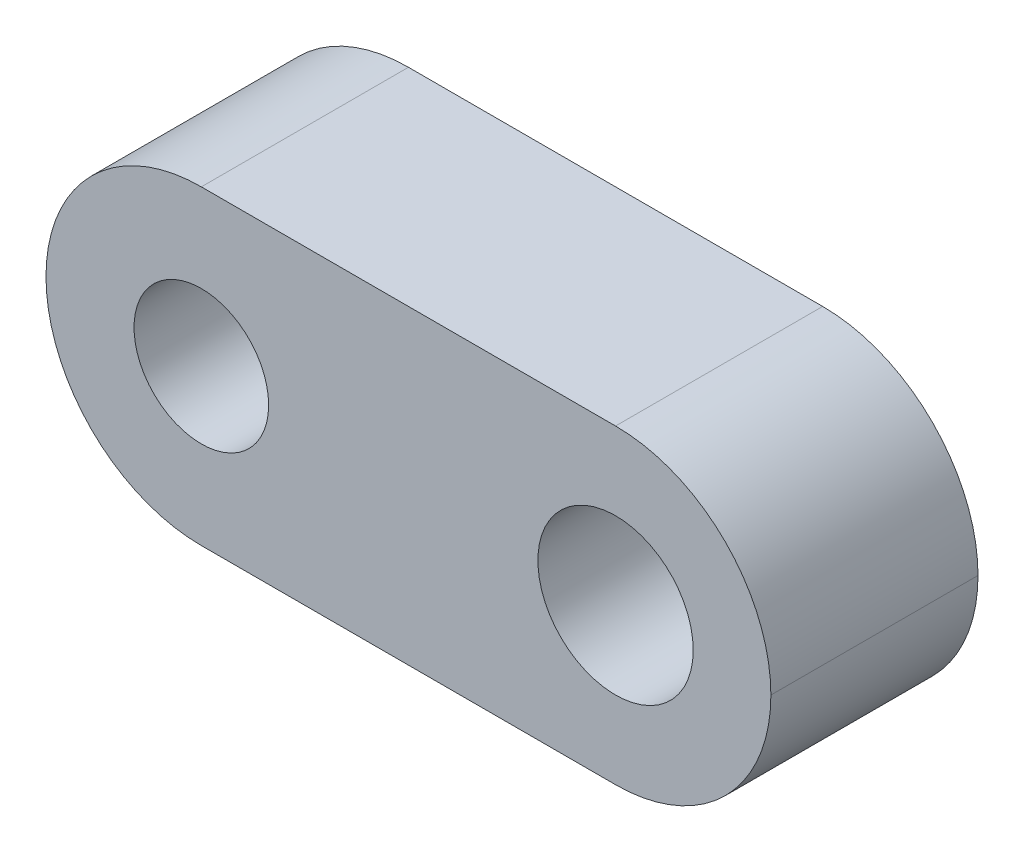
from build123d import *

# Parameters (mm, degrees)
SKETCH1_W               = 14
SKETCH1_H               = 6
BOSS_EXTRUDE1_DEPTH     = 4
CUT_EXTRUDE1_DEPTH      = 16.748015748
CUT_EXTRUDE1_DEPTH_BACK = 16.748015748
SKETCH2_R               = 1.3
SKETCH2_R_2             = 1.5
FILLET1_R               = 3


with BuildPart() as part:
    # Sketch1 → Boss-Extrude1 (new body)
    with BuildSketch(Plane.XY):
        with Locations((7, -3)):
            Rectangle(SKETCH1_W, SKETCH1_H)
    extrude(amount=BOSS_EXTRUDE1_DEPTH)

    # Sketch2 → Cut-Extrude1 (cut, two sides: drawn at the far end of the back side and taken through both)
    with BuildSketch(Plane.XY.offset(4).offset(-CUT_EXTRUDE1_DEPTH_BACK)):
        with Locations((3, -3)):
            Circle(SKETCH2_R)
        with Locations((11, -3)):
            Circle(SKETCH2_R_2)
    extrude(amount=CUT_EXTRUDE1_DEPTH + CUT_EXTRUDE1_DEPTH_BACK, mode=Mode.SUBTRACT)

    # Fillet1
    fillet1_edges = [part.edges().sort_by_distance(p)[0] for p in [
        (14, -6, 2),
        (14, 0, 2),
        (0, -6, 2),
        (0, 0, 2),
    ]]
    fillet(fillet1_edges, radius=FILLET1_R - 0.0001)  # a hair under: the kernel refuses the full size


solid = part.part
